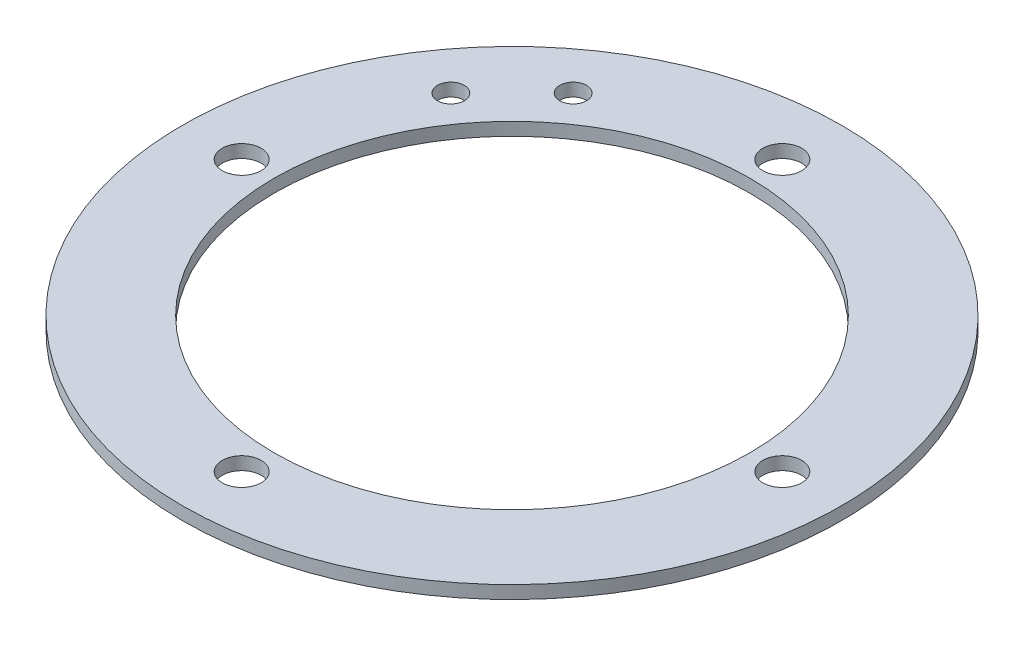
from build123d import *

# Parameters (mm, degrees)
SKETCH1_R           = 76.2
SKETCH1_R_2         = 4.5
SKETCH1_R_3         = 55
BOSS_EXTRUDE1_DEPTH = 3
SKETCH2_R           = 3.1
CUT_EXTRUDE1_DEPTH  = 3


with BuildPart() as part:
    # Sketch1 → Boss-Extrude1 (new body)
    with BuildSketch(Plane(origin=(0, 0, 0), x_dir=(1, 0, 0), z_dir=(0, 1, 0))):
        Circle(SKETCH1_R)
        with Locations((0, 62.5)):
            Circle(SKETCH1_R_2, mode=Mode.SUBTRACT)
        with Locations((62.5, 0)):
            Circle(SKETCH1_R_2, mode=Mode.SUBTRACT)
        with Locations((0, -62.5)):
            Circle(SKETCH1_R_2, mode=Mode.SUBTRACT)
        with Locations((-62.5, 0)):
            Circle(SKETCH1_R_2, mode=Mode.SUBTRACT)
        Circle(SKETCH1_R_3, mode=Mode.SUBTRACT)
    extrude(amount=BOSS_EXTRUDE1_DEPTH)

    # Sketch2 → Cut-Extrude1 (cut)
    with BuildSketch(Plane(origin=(0, 3, 0), x_dir=(1, 0, 0), z_dir=(0, 1, 0))):
        with Locations((-51.618795027, 37.476659403)):
            Circle(SKETCH2_R)
        with Locations((-37.476659403, 51.618795027)):
            Circle(SKETCH2_R)
    extrude(amount=-CUT_EXTRUDE1_DEPTH, mode=Mode.SUBTRACT)


solid = part.part
